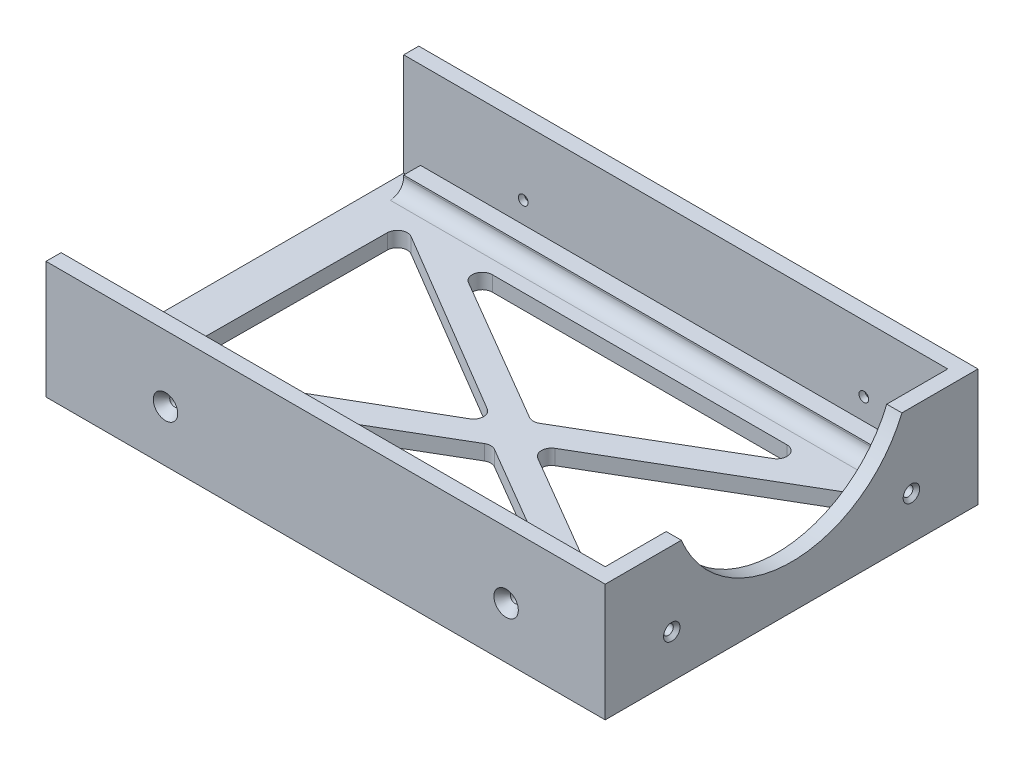
from build123d import *
from OCP.BRepFilletAPI import BRepFilletAPI_MakeChamfer

# Parameters (mm, degrees)
SKETCH1_W                     = 166.5
SKETCH1_H                     = 111
BOSS_EXTRUDE1_DEPTH           = 30.5
SHELL1_T                      = -4.5
CUT_EXTRUDE1_REACH            = 105.377
SKETCH2_W                     = 157
SKETCH2_H                     = 92
TAP_DRILL_FOR_6_32_TAP1_D     = 2.90068
TAP_DRILL_FOR_6_32_TAP1_DEPTH = 4.5
LPATTERN1_COUNT               = 8
LPATTERN1_PITCH               = 30.5
SKETCH7_W                     = 102
SKETCH7_H                     = 4.5
CUT_EXTRUDE2_DEPTH            = 5
SKETCH8_W                     = 102
SKETCH8_H                     = 157
CUT_EXTRUDE3_DEPTH            = 5
CUT_EXTRUDE4_REACH            = 302.564
SKETCH9_R                     = 35.5
TAP_DRILL_FOR_6_32_TAP2_D     = 2.90068
SKETCH13_W                    = 166.5
SKETCH13_H                    = 92
BOSS_EXTRUDE2_DEPTH           = 4.5
CUT_EXTRUDE7_DEPTH            = 157
MIRROR6_COPY_1_DEPTH          = 157
CUT_EXTRUDE11_REACH           = 364.095
SKETCH31_W                    = 5
SKETCH31_H                    = 102
SKETCH33_W                    = 4.5
SKETCH33_H                    = 149.2
BOSS_EXTRUDE3_DEPTH           = 4.5
LPATTERN2_COUNT               = 3
LPATTERN2_PITCH               = 81
CUT_EXTRUDE12_REACH           = 394.531
SKETCH34_W                    = 4.5
SKETCH34_H                    = 11.5
SKETCH35_W                    = 4.5
SKETCH35_H                    = 149.2
BOSS_EXTRUDE4_DEPTH           = 4.5
SKETCH36_W                    = 14
SKETCH36_H                    = 38
SKETCH36_W_2                  = 24
SKETCH36_H_2                  = 12
SKETCH36_W_3                  = 12
SKETCH36_H_3                  = 14
BOSS_EXTRUDE5_DEPTH           = 4.5
CUT_EXTRUDE13_REACH           = 394.531
SKETCH37_R                    = 1.45
BOSS_EXTRUDE6_START           = -4.5
BOSS_EXTRUDE6_DEPTH           = 4.5
SKETCH39_R                    = 3.5
CUT_EXTRUDE14_DEPTH           = 2.5
CUT_EXTRUDE14_DRAFT           = -39
CUT_EXTRUDE14_PROFILE_2_DEPTH = 2.5
CUT_EXTRUDE14_PROFILE_2_DRAFT = -39
CUT_EXTRUDE14_PROFILE_3_DEPTH = 2.5
CUT_EXTRUDE14_PROFILE_3_DRAFT = -39
CUT_EXTRUDE14_PROFILE_4_DEPTH = 2.5
CUT_EXTRUDE14_PROFILE_4_DRAFT = -39
CHAMFER1_SIZE                 = 4.5
SKETCH41_W                    = 166.5
SKETCH41_H                    = 314
BOSS_EXTRUDE7_DEPTH           = 4.5
CUT_EXTRUDE15_REACH           = 367.087
CHAMFER2_SIZE                 = 2.7
CHAMFER2_SIZE2                = 2.18641689
CHAMFER3_SIZE                 = 2.7
CHAMFER3_SIZE2                = 2.18641689
CHAMFER4_SIZE                 = 2.7
CHAMFER4_SIZE2                = 2.18641689
CHAMFER5_SIZE                 = 1
FILLET1_R                     = 4
FILLET2_R                     = 4
FILLET3_R                     = 4
CHAMFER6_SIZE                 = 20
CUT_EXTRUDE16_DEPTH           = 393.530890547
CUT_EXTRUDE16_DEPTH_BACK      = 393.530890547


with BuildPart() as part:
    # Sketch1 → Boss-Extrude1 (new body)
    with BuildSketch(Plane(origin=(0, 0, 0), x_dir=(1, 0, 0), z_dir=(0, 1, 0))):
        Rectangle(SKETCH1_W, SKETCH1_H)
    extrude(amount=BOSS_EXTRUDE1_DEPTH)

    # Shell1
    shell1_openings = [part.faces().sort_by_distance(p)[0] for p in [
        (0, 30.5, 0),
        (-83.25, 15.25, 0),
    ]]
    offset(amount=SHELL1_T, openings=shell1_openings, kind=Kind.INTERSECTION)

    # Sketch2 → Cut-Extrude1 (cut, up to next)
    with BuildSketch(Plane(origin=(0, 4.5, 0), x_dir=(1, 0, 0), z_dir=(0, 1, 0)), mode=Mode.PRIVATE) as cut_extrude1_sk1:
        with Locations((0.25, 0)):
            Rectangle(SKETCH2_W, SKETCH2_H)
    cut_extrude1_tool1 = extrude(cut_extrude1_sk1.sketch, amount=-CUT_EXTRUDE1_REACH, mode=Mode.PRIVATE) & part.part
    add(cut_extrude1_tool1.solids().sort_by_distance((0.25, 4.5, 0))[0], mode=Mode.SUBTRACT)

    # Tap Drill for #6-32 Tap1
    with Locations(Plane(origin=(0, 0, -55.5), x_dir=(-1, 0, 0), z_dir=(0, 0, -1))):
        with Locations((47.66, 10.84), (-53.75, 10.84)):
            tap_drill_for_6_32_tap1 = Hole(TAP_DRILL_FOR_6_32_TAP1_D / 2, depth=TAP_DRILL_FOR_6_32_TAP1_DEPTH)

    # Mirror1: Tap Drill for #6-32 Tap1 across plane
    add(tap_drill_for_6_32_tap1.mirror(Plane.XY), mode=Mode.SUBTRACT)


with BuildPart() as lpattern1_1:
    # LPattern1: pattern copy
    add(part.part.moved(Location(Vector(0, 1, 0) * (1 * LPATTERN1_PITCH))))


with BuildPart() as lpattern1_2:
    # LPattern1: pattern copy
    add(part.part.moved(Location(Vector(0, 1, 0) * (2 * LPATTERN1_PITCH))))


with BuildPart() as lpattern1_3:
    # LPattern1: pattern copy
    add(part.part.moved(Location(Vector(0, 1, 0) * (3 * LPATTERN1_PITCH))))


with BuildPart() as lpattern1_4:
    # LPattern1: pattern copy
    add(part.part.moved(Location(Vector(0, 1, 0) * (4 * LPATTERN1_PITCH))))


with BuildPart() as lpattern1_5:
    # LPattern1: pattern copy
    add(part.part.moved(Location(Vector(0, 1, 0) * (5 * LPATTERN1_PITCH))))


with BuildPart() as lpattern1_6:
    # LPattern1: pattern copy
    add(part.part.moved(Location(Vector(0, 1, 0) * (6 * LPATTERN1_PITCH))))


with BuildPart() as lpattern1_7:
    # LPattern1: pattern copy
    add(part.part.moved(Location(Vector(0, 1, 0) * (7 * LPATTERN1_PITCH))))


with BuildPart() as part_1:
    add(part.part)

    # Combine1: union LPattern1_1
    add(lpattern1_1.part)

    # Sketch7 → Cut-Extrude2 (cut)
    with BuildSketch(Plane.ZY.offset(83.25)):
        with Locations((0, 32.75)):
            Rectangle(SKETCH7_W, SKETCH7_H)
    extrude(amount=-CUT_EXTRUDE2_DEPTH, mode=Mode.SUBTRACT)


with BuildPart() as lpattern1_2_1:
    add(lpattern1_2.part)

    # Combine2: union LPattern1_3, LPattern1_5, LPattern1_4, LPattern1_7, part, LPattern1_6
    add(lpattern1_3.part)
    add(lpattern1_5.part)
    add(lpattern1_4.part)
    add(lpattern1_7.part)
    add(part_1.part)
    add(lpattern1_6.part)

    # Sketch8 → Cut-Extrude3 (cut)
    with BuildSketch(Plane.ZY.offset(83.25)):
        with Locations((0, 139.5)):
            Rectangle(SKETCH8_W, SKETCH8_H)
    extrude(amount=-CUT_EXTRUDE3_DEPTH, mode=Mode.SUBTRACT)

    # Sketch9 → Cut-Extrude4 (cut, up to next)
    with BuildSketch(Plane(origin=(83.25, 0, 0), x_dir=(0, 0, -1), z_dir=(1, 0, 0)), mode=Mode.PRIVATE) as cut_extrude4_sk1:
        with Locations((0, 204)):
            Circle(SKETCH9_R)
    cut_extrude4_tool1 = extrude(cut_extrude4_sk1.sketch, amount=-CUT_EXTRUDE4_REACH, mode=Mode.PRIVATE) & lpattern1_2_1.part
    # Sketch9 → Cut-Extrude4 (cut, up to next)
    with BuildSketch(Plane(origin=(83.25, 0, 0), x_dir=(0, 0, -1), z_dir=(1, 0, 0)), mode=Mode.PRIVATE) as cut_extrude4_sk2:
        with Locations((0, 124)):
            Circle(SKETCH9_R)
    cut_extrude4_tool2 = extrude(cut_extrude4_sk2.sketch, amount=-CUT_EXTRUDE4_REACH, mode=Mode.PRIVATE) & lpattern1_2_1.part
    # Sketch9 → Cut-Extrude4 (cut, up to next)
    with BuildSketch(Plane(origin=(83.25, 0, 0), x_dir=(0, 0, -1), z_dir=(1, 0, 0)), mode=Mode.PRIVATE) as cut_extrude4_sk3:
        with Locations((0, 44)):
            Circle(SKETCH9_R)
    cut_extrude4_tool3 = extrude(cut_extrude4_sk3.sketch, amount=-CUT_EXTRUDE4_REACH, mode=Mode.PRIVATE) & lpattern1_2_1.part
    add(cut_extrude4_tool1.solids().sort_by_distance((83.25, 204, 0))[0], mode=Mode.SUBTRACT)
    add(cut_extrude4_tool2.solids().sort_by_distance((83.25, 124, 0))[0], mode=Mode.SUBTRACT)
    add(cut_extrude4_tool3.solids().sort_by_distance((83.25, 44, 0))[0], mode=Mode.SUBTRACT)

    # Tap Drill for #6-32 Tap2 (through all)
    with Locations(Plane(origin=(83.25, 0, 0), x_dir=(0, 0, -1), z_dir=(1, 0, 0))):
        with Locations((-35.675, 239.675), (35.675, 239.675), (35.675, 168.325), (-35.675, 168.325)):
            tap_drill_for_6_32_tap2 = Hole(TAP_DRILL_FOR_6_32_TAP2_D / 2)

    # Mirror2: Tap Drill for #6-32 Tap2 across plane
    add(tap_drill_for_6_32_tap2.mirror(Plane.ZX.offset(164)), mode=Mode.SUBTRACT)

    # Mirror3: Tap Drill for #6-32 Tap2 across plane
    add(tap_drill_for_6_32_tap2.mirror(Plane.ZX.offset(124)), mode=Mode.SUBTRACT)

    # Sketch13 → Boss-Extrude2 (add)
    with BuildSketch(Plane.XZ):
        with Locations((0, -101.5)):
            Rectangle(SKETCH13_W, SKETCH13_H)
    extrude(amount=-BOSS_EXTRUDE2_DEPTH)

    # Mirror4: LPattern1_2 across plane


with BuildPart() as lpattern1_2_2:
    add(lpattern1_2_1.part)
    add(lpattern1_2_1.part.mirror(Plane(origin=(0, 0, -101.5), x_dir=(1, 0, 0), z_dir=(0, 0, -1))))

    # Sketch17 → Cut-Extrude7 (cut)
    with BuildSketch(Plane.ZY.offset(78.25)):
        Polygon((-46, 35), (-51, 30.5), (-46, 30.5), align=None)
        Polygon((-51, 61), (-46, 65.5), (-46, 61), align=None)
        Polygon((-51, 91.5), (-46, 96), (-46, 91.5), align=None)
        Polygon((-51, 122), (-46, 126.5), (-46, 122), align=None)
        Polygon((-51, 152.5), (-46, 157), (-46, 152.5), align=None)
        Polygon((-51, 183), (-46, 187.5), (-46, 183), align=None)
        Polygon((-51, 213.5), (-46, 218), (-46, 213.5), align=None)
    cut_extrude7 = extrude(amount=-CUT_EXTRUDE7_DEPTH, mode=Mode.SUBTRACT)

    # Mirror5: Cut-Extrude7 across plane
    add(cut_extrude7.mirror(Plane.XY), mode=Mode.SUBTRACT)

    # Mirror6: Cut-Extrude7 across plane
    add(cut_extrude7.mirror(Plane(origin=(0, 0, -101.5), x_dir=(1, 0, 0), z_dir=(0, 0, -1))), mode=Mode.SUBTRACT)

    # Mirror6 copy 1 sketch → Mirror6 copy 1 (cut)
    with BuildSketch(Plane(origin=(-78.25, 0, -203), x_dir=(0, 0, 1), z_dir=(-1, 0, 0))):
        Polygon((-46, 35), (-51, 30.5), (-46, 30.5), align=None)
        Polygon((-51, 61), (-46, 65.5), (-46, 61), align=None)
        Polygon((-51, 91.5), (-46, 96), (-46, 91.5), align=None)
        Polygon((-51, 122), (-46, 126.5), (-46, 122), align=None)
        Polygon((-51, 152.5), (-46, 157), (-46, 152.5), align=None)
        Polygon((-51, 183), (-46, 187.5), (-46, 183), align=None)
        Polygon((-51, 213.5), (-46, 218), (-46, 213.5), align=None)
    extrude(amount=-MIRROR6_COPY_1_DEPTH, mode=Mode.SUBTRACT)

    # Sketch31 → Cut-Extrude11 (cut, up to next)
    with BuildSketch(Plane(origin=(0, 4.5, 0), x_dir=(1, 0, 0), z_dir=(0, 1, 0)), mode=Mode.PRIVATE) as cut_extrude11_sk1:
        with Locations((-80.75, 203)):
            Rectangle(SKETCH31_W, SKETCH31_H)
    cut_extrude11_tool1 = extrude(cut_extrude11_sk1.sketch, amount=-CUT_EXTRUDE11_REACH, mode=Mode.PRIVATE) & lpattern1_2_2.part
    # Sketch31 → Cut-Extrude11 (cut, up to next)
    with BuildSketch(Plane(origin=(0, 4.5, 0), x_dir=(1, 0, 0), z_dir=(0, 1, 0)), mode=Mode.PRIVATE) as cut_extrude11_sk2:
        with Locations((-80.75, 0)):
            Rectangle(SKETCH31_W, SKETCH31_H)
    cut_extrude11_tool2 = extrude(cut_extrude11_sk2.sketch, amount=-CUT_EXTRUDE11_REACH, mode=Mode.PRIVATE) & lpattern1_2_2.part
    add(cut_extrude11_tool1.solids().sort_by_distance((-80.75, 4.5, -203))[0], mode=Mode.SUBTRACT)
    add(cut_extrude11_tool2.solids().sort_by_distance((-80.75, 4.5, 0))[0], mode=Mode.SUBTRACT)

    # Sketch33 → Boss-Extrude3 (add)
    with BuildSketch(Plane(origin=(83.25, 0, 0), x_dir=(0, 0, -1), z_dir=(1, 0, 0))):
        with Locations((145.25, 79.1)):
            Rectangle(SKETCH33_W, SKETCH33_H)
    boss_extrude3 = extrude(amount=-BOSS_EXTRUDE3_DEPTH)

    # LPattern2: Boss-Extrude3 ×3
    with Locations(*[(-i * LPATTERN2_PITCH, 0, 0) for i in range(1, LPATTERN2_COUNT)]):
        add(boss_extrude3)

    # Cut-Extrude12: up to this face of the body (flat: up to its plane)
    cut_extrude12_end = Plane(lpattern1_2_2.part.faces().sort_by_distance((2.25, 79.1, -145.25))[0])
    # Sketch34 → Cut-Extrude12 (cut, up to the picked face)
    with BuildSketch(Plane.ZY.offset(83.25), mode=Mode.PRIVATE) as cut_extrude12_sk1:
        Polygon((-147.5, 25), (-143, 25), (-143, 81.35), (-147.5, 76.85), align=None)
    cut_extrude12_tool1 = split(extrude(cut_extrude12_sk1.sketch, amount=-CUT_EXTRUDE12_REACH, mode=Mode.PRIVATE), bisect_by=cut_extrude12_end, keep=Keep.BOTH, mode=Mode.PRIVATE)
    # Sketch34 → Cut-Extrude12 (cut, up to the picked face)
    with BuildSketch(Plane.ZY.offset(83.25), mode=Mode.PRIVATE) as cut_extrude12_sk2:
        with Locations((-145.25, 19.25)):
            Rectangle(SKETCH34_W, SKETCH34_H)
    cut_extrude12_tool2 = split(extrude(cut_extrude12_sk2.sketch, amount=-CUT_EXTRUDE12_REACH, mode=Mode.PRIVATE), bisect_by=cut_extrude12_end, keep=Keep.BOTH, mode=Mode.PRIVATE)
    # Sketch34 → Cut-Extrude12 (cut, up to the picked face)
    with BuildSketch(Plane.ZY.offset(83.25), mode=Mode.PRIVATE) as cut_extrude12_sk3:
        Polygon((-143, 145.7), (-143, 89.35), (-147.5, 89.35), (-147.5, 141.2), align=None)
    cut_extrude12_tool3 = split(extrude(cut_extrude12_sk3.sketch, amount=-CUT_EXTRUDE12_REACH, mode=Mode.PRIVATE), bisect_by=cut_extrude12_end, keep=Keep.BOTH, mode=Mode.PRIVATE)
    add(cut_extrude12_tool1.solids().sort_by(Axis((-83.25, 52.065596, -145.218808), (1, 0, 0)))[0], mode=Mode.SUBTRACT)
    add(cut_extrude12_tool2.solids().sort_by(Axis((-83.25, 19.25, -145.25), (1, 0, 0)))[0], mode=Mode.SUBTRACT)
    add(cut_extrude12_tool3.solids().sort_by(Axis((-83.25, 116.415596, -145.218808), (1, 0, 0)))[0], mode=Mode.SUBTRACT)

    # Sketch35 → Boss-Extrude4 (add)
    with BuildSketch(Plane.ZY.offset(-78.75)):
        with Locations((-145.25, 79.1)):
            Rectangle(SKETCH35_W, SKETCH35_H)
    extrude(amount=BOSS_EXTRUDE4_DEPTH)

    # Sketch36 → Boss-Extrude5 (add)
    with BuildSketch(Plane(origin=(83.25, 0, 0), x_dir=(0, 0, -1), z_dir=(1, 0, 0))):
        with Locations((62.5, 23.5)):
            Rectangle(SKETCH36_W, SKETCH36_H)
        with Locations((67.5, 147.7)):
            Rectangle(SKETCH36_W_2, SKETCH36_H_2)
        with Locations((137, 146.7)):
            Rectangle(SKETCH36_W_3, SKETCH36_H_3)
        with Locations((136, 10.5)):
            Rectangle(SKETCH36_W, SKETCH36_H_2)
    extrude(amount=-BOSS_EXTRUDE5_DEPTH)

    # Sketch37 → Cut-Extrude13 (cut, up to next)
    with BuildSketch(Plane(origin=(83.25, 0, 0), x_dir=(0, 0, -1), z_dir=(1, 0, 0)), mode=Mode.PRIVATE) as cut_extrude13_sk1:
        with Locations((71.32, 147.92)):
            Circle(SKETCH37_R)
    cut_extrude13_tool1 = extrude(cut_extrude13_sk1.sketch, amount=-CUT_EXTRUDE13_REACH, mode=Mode.PRIVATE) & lpattern1_2_2.part
    # Sketch37 → Cut-Extrude13 (cut, up to next)
    with BuildSketch(Plane(origin=(83.25, 0, 0), x_dir=(0, 0, -1), z_dir=(1, 0, 0)), mode=Mode.PRIVATE) as cut_extrude13_sk2:
        with Locations((137.68, 147.92)):
            Circle(SKETCH37_R)
    cut_extrude13_tool2 = extrude(cut_extrude13_sk2.sketch, amount=-CUT_EXTRUDE13_REACH, mode=Mode.PRIVATE) & lpattern1_2_2.part
    # Sketch37 → Cut-Extrude13 (cut, up to next)
    with BuildSketch(Plane(origin=(83.25, 0, 0), x_dir=(0, 0, -1), z_dir=(1, 0, 0)), mode=Mode.PRIVATE) as cut_extrude13_sk3:
        with Locations((61.57, 34.51)):
            Circle(SKETCH37_R)
    cut_extrude13_tool3 = extrude(cut_extrude13_sk3.sketch, amount=-CUT_EXTRUDE13_REACH, mode=Mode.PRIVATE) & lpattern1_2_2.part
    # Sketch37 → Cut-Extrude13 (cut, up to next)
    with BuildSketch(Plane(origin=(83.25, 0, 0), x_dir=(0, 0, -1), z_dir=(1, 0, 0)), mode=Mode.PRIVATE) as cut_extrude13_sk4:
        with Locations((137.55, 10.15)):
            Circle(SKETCH37_R)
    cut_extrude13_tool4 = extrude(cut_extrude13_sk4.sketch, amount=-CUT_EXTRUDE13_REACH, mode=Mode.PRIVATE) & lpattern1_2_2.part
    add(cut_extrude13_tool1.solids().sort_by_distance((83.25, 147.92, -71.32))[0], mode=Mode.SUBTRACT)
    add(cut_extrude13_tool2.solids().sort_by_distance((83.25, 147.92, -137.68))[0], mode=Mode.SUBTRACT)
    add(cut_extrude13_tool3.solids().sort_by_distance((83.25, 34.51, -61.57))[0], mode=Mode.SUBTRACT)
    add(cut_extrude13_tool4.solids().sort_by_distance((83.25, 10.15, -137.55))[0], mode=Mode.SUBTRACT)

    # Sketch38 → Boss-Extrude6 (add)
    with BuildSketch(Plane(origin=(83.25, 0, 0), x_dir=(0, 0, -1), z_dir=(1, 0, 0)).offset(BOSS_EXTRUDE6_START)):
        Polygon((79.5, 141.7), (55.5, 117.7), (55.5, 141.7), align=None)
        Polygon((131, 139.7), (143, 127.7), (143, 139.7), align=None)
    extrude(amount=BOSS_EXTRUDE6_DEPTH)


with BuildPart() as cut_extrude14_tool:
    # Sketch39 → Cut-Extrude14 (with draft: the straight prism first)
    with BuildSketch(Plane(origin=(83.25, 0, 0), x_dir=(0, 0, -1), z_dir=(1, 0, 0))):
        with Locations((71.32, 147.92)):
            Circle(SKETCH39_R)
    extrude(amount=-CUT_EXTRUDE14_DEPTH)
    # Cut-Extrude14: the draft: its side faces are tilted about the plane it starts from
    cut_extrude14_sides = [cut_extrude14_tool.faces().sort_by_distance(p)[0] for p in [
        (82, 147.92, -67.82),
    ]]
    draft(cut_extrude14_sides, Plane(origin=(83.25, 0, 0), x_dir=(0, 0, -1), z_dir=(1, 0, 0)), CUT_EXTRUDE14_DRAFT)


with BuildPart() as lpattern1_2_3:
    add(lpattern1_2_2.part)

    # Cut-Extrude14: cut by cut_extrude14_tool
    add(cut_extrude14_tool.part, mode=Mode.SUBTRACT)


with BuildPart() as cut_extrude14_profile_2_tool:
    # Sketch39 → Cut-Extrude14 profile 2 (with draft: the straight prism first)
    with BuildSketch(Plane(origin=(83.25, 0, 0), x_dir=(0, 0, -1), z_dir=(1, 0, 0))):
        with Locations((137.68, 147.92)):
            Circle(SKETCH39_R)
    extrude(amount=-CUT_EXTRUDE14_PROFILE_2_DEPTH)
    # Cut-Extrude14 profile 2: the draft: its side faces are tilted about the plane it starts from
    cut_extrude14_profile_2_sides = [cut_extrude14_profile_2_tool.faces().sort_by_distance(p)[0] for p in [
        (82, 147.92, -134.18),
    ]]
    draft(cut_extrude14_profile_2_sides, Plane(origin=(83.25, 0, 0), x_dir=(0, 0, -1), z_dir=(1, 0, 0)), CUT_EXTRUDE14_PROFILE_2_DRAFT)


with BuildPart() as lpattern1_2_4:
    add(lpattern1_2_3.part)

    # Cut-Extrude14 profile 2: cut by cut_extrude14_profile_2_tool
    add(cut_extrude14_profile_2_tool.part, mode=Mode.SUBTRACT)


with BuildPart() as cut_extrude14_profile_3_tool:
    # Sketch39 → Cut-Extrude14 profile 3 (with draft: the straight prism first)
    with BuildSketch(Plane(origin=(83.25, 0, 0), x_dir=(0, 0, -1), z_dir=(1, 0, 0))):
        with Locations((137.55, 10.15)):
            Circle(SKETCH39_R)
    extrude(amount=-CUT_EXTRUDE14_PROFILE_3_DEPTH)
    # Cut-Extrude14 profile 3: the draft: its side faces are tilted about the plane it starts from
    cut_extrude14_profile_3_sides = [cut_extrude14_profile_3_tool.faces().sort_by_distance(p)[0] for p in [
        (82, 10.15, -134.05),
    ]]
    draft(cut_extrude14_profile_3_sides, Plane(origin=(83.25, 0, 0), x_dir=(0, 0, -1), z_dir=(1, 0, 0)), CUT_EXTRUDE14_PROFILE_3_DRAFT)


with BuildPart() as lpattern1_2_5:
    add(lpattern1_2_4.part)

    # Cut-Extrude14 profile 3: cut by cut_extrude14_profile_3_tool
    add(cut_extrude14_profile_3_tool.part, mode=Mode.SUBTRACT)


with BuildPart() as cut_extrude14_profile_4_tool:
    # Sketch39 → Cut-Extrude14 profile 4 (with draft: the straight prism first)
    with BuildSketch(Plane(origin=(83.25, 0, 0), x_dir=(0, 0, -1), z_dir=(1, 0, 0))):
        with Locations((61.57, 34.51)):
            Circle(SKETCH39_R)
    extrude(amount=-CUT_EXTRUDE14_PROFILE_4_DEPTH)
    # Cut-Extrude14 profile 4: the draft: its side faces are tilted about the plane it starts from
    cut_extrude14_profile_4_sides = [cut_extrude14_profile_4_tool.faces().sort_by_distance(p)[0] for p in [
        (82, 34.51, -58.07),
    ]]
    draft(cut_extrude14_profile_4_sides, Plane(origin=(83.25, 0, 0), x_dir=(0, 0, -1), z_dir=(1, 0, 0)), CUT_EXTRUDE14_PROFILE_4_DRAFT)


with BuildPart() as lpattern1_2_6:
    add(lpattern1_2_5.part)

    # Cut-Extrude14 profile 4: cut by cut_extrude14_profile_4_tool
    add(cut_extrude14_profile_4_tool.part, mode=Mode.SUBTRACT)

    # Chamfer1
    chamfer1_edges = [lpattern1_2_6.edges().sort_by_distance(p)[0] for p in [
        (81, 42.5, -69.5),
        (81, 153.7, -79.5),
        (81, 153.7, -131),
        (81, 16.5, -129),
    ]]
    chamfer(chamfer1_edges, length=CHAMFER1_SIZE)

    # Sketch41 → Boss-Extrude7 (add)
    with BuildSketch(Plane.XZ):
        with Locations((0, -101.5)):
            Rectangle(SKETCH41_W, SKETCH41_H)
    extrude(amount=BOSS_EXTRUDE7_DEPTH)

    # Sketch42 → Cut-Extrude15 (cut, up to next)
    with BuildSketch(Plane(origin=(0, 0, 0), x_dir=(1, 0, 0), z_dir=(0, 1, 0)), mode=Mode.PRIVATE) as cut_extrude15_sk1:
        with BuildLine():
            Line((-43.85503675, 38), (43.85503675, 38))
            ThreePointArc((43.85503675, 38), (46.750439422, 35.78526643), (45.370811763, 32.411095577))
            Line((45.370811763, 32.411095577), (1.515775013, 6.73445479))
            ThreePointArc((1.515775013, 6.73445479), (0, 6.323359212), (-1.515775013, 6.73445479))
            Line((-1.515775013, 6.73445479), (-45.370811763, 32.411095577))
            ThreePointArc((-45.370811763, 32.411095577), (-46.750439422, 35.78526643), (-43.85503675, 38))
        make_face()
    cut_extrude15_tool1 = extrude(cut_extrude15_sk1.sketch, amount=-CUT_EXTRUDE15_REACH, mode=Mode.PRIVATE) & lpattern1_2_6.part
    # Sketch42 → Cut-Extrude15 (cut, up to next)
    with BuildSketch(Plane(origin=(0, 0, 0), x_dir=(1, 0, 0), z_dir=(0, 1, 0)), mode=Mode.PRIVATE) as cut_extrude15_sk2:
        with BuildLine():
            Line((10.268766853, 2.588904423), (66.234224987, 35.356063488))
            ThreePointArc((66.234224987, 35.356063488), (69.242091646, 35.369785147), (70.75, 32.767159066))
            Line((70.75, 32.767159066), (70.75, -32.767159066))
            ThreePointArc((70.75, -32.767159066), (69.242091646, -35.369785147), (66.234224987, -35.356063488))
            Line((66.234224987, -35.356063488), (10.268766853, -2.588904423))
            ThreePointArc((10.268766853, -2.588904423), (8.784541866, 0), (10.268766853, 2.588904423))
        make_face()
    cut_extrude15_tool2 = extrude(cut_extrude15_sk2.sketch, amount=-CUT_EXTRUDE15_REACH, mode=Mode.PRIVATE) & lpattern1_2_6.part
    # Sketch42 → Cut-Extrude15 (cut, up to next)
    with BuildSketch(Plane(origin=(0, 0, 0), x_dir=(1, 0, 0), z_dir=(0, 1, 0)), mode=Mode.PRIVATE) as cut_extrude15_sk3:
        with BuildLine():
            Line((45.370811763, -32.411095577), (1.515775013, -6.73445479))
            ThreePointArc((1.515775013, -6.73445479), (0, -6.323359212), (-1.515775013, -6.73445479))
            Line((-1.515775013, -6.73445479), (-45.370811763, -32.411095577))
            ThreePointArc((-45.370811763, -32.411095577), (-46.750439422, -35.78526643), (-43.85503675, -38))
            Line((-43.85503675, -38), (43.85503675, -38))
            ThreePointArc((43.85503675, -38), (46.750439422, -35.78526643), (45.370811763, -32.411095577))
        make_face()
    cut_extrude15_tool3 = extrude(cut_extrude15_sk3.sketch, amount=-CUT_EXTRUDE15_REACH, mode=Mode.PRIVATE) & lpattern1_2_6.part
    # Sketch42 → Cut-Extrude15 (cut, up to next)
    with BuildSketch(Plane(origin=(0, 0, 0), x_dir=(1, 0, 0), z_dir=(0, 1, 0)), mode=Mode.PRIVATE) as cut_extrude15_sk4:
        with BuildLine():
            Line((-70.717599058, 32.346124545), (-70.327517287, -33.187032629))
            ThreePointArc((-70.327517287, -33.187032629), (-68.804143961, -35.780637039), (-65.796412263, -35.749011813))
            Line((-65.796412263, -35.749011813), (-10.026986458, -2.64930845))
            ThreePointArc((-10.026986458, -2.64930845), (-8.558197773, -0.051615297), (-10.057806476, 2.528408669))
            Line((-10.057806476, 2.528408669), (-66.217314052, 34.961862479))
            ThreePointArc((-66.217314052, 34.961862479), (-69.225209102, 34.957680085), (-70.717599058, 32.346124545))
        make_face()
    cut_extrude15_tool4 = extrude(cut_extrude15_sk4.sketch, amount=-CUT_EXTRUDE15_REACH, mode=Mode.PRIVATE) & lpattern1_2_6.part
    cut_extrude15_1 = cut_extrude15_tool1.solids().sort_by_distance((0, 0, -27.06052))[0]
    add(cut_extrude15_1, mode=Mode.SUBTRACT)
    cut_extrude15_2 = cut_extrude15_tool2.solids().sort_by_distance((49.111692, 0, 0))[0]
    add(cut_extrude15_2, mode=Mode.SUBTRACT)
    cut_extrude15_3 = cut_extrude15_tool3.solids().sort_by_distance((0, 0, 27.06052))[0]
    add(cut_extrude15_3, mode=Mode.SUBTRACT)
    cut_extrude15_4 = cut_extrude15_tool4.solids().sort_by_distance((-48.884634, 0, 0.291656))[0]
    add(cut_extrude15_4, mode=Mode.SUBTRACT)
    cut_extrude15 = cut_extrude15_1 + cut_extrude15_2 + cut_extrude15_3 + cut_extrude15_4  # Cut-Extrude15 as one shape, for the pattern or mirror that repeats it

    # Mirror7: Cut-Extrude15 across plane
    add(cut_extrude15.mirror(Plane(origin=(0, 0, -101.5), x_dir=(1, 0, 0), z_dir=(0, 0, -1))), mode=Mode.SUBTRACT)

    # Chamfer2
    chamfer2_edges = [lpattern1_2_6.edges().sort_by_distance(p)[0] for p in [
        (52.29966, 10.84, 55.5),
        (-49.11034, 10.84, 55.5),
        (52.29966, 41.34, 55.5),
        (-49.11034, 41.34, 55.5),
        (52.29966, 71.84, 55.5),
        (-49.11034, 71.84, 55.5),
        (52.29966, 102.34, 55.5),
        (-49.11034, 102.34, 55.5),
        (52.29966, 163.34, 55.5),
        (-49.11034, 163.34, 55.5),
        (52.29966, 132.84, 55.5),
        (-49.11034, 132.84, 55.5),
        (52.29966, 224.34, 55.5),
        (-49.11034, 224.34, 55.5),
        (52.29966, 193.84, 55.5),
        (-49.11034, 193.84, 55.5),
    ]]
    chamfer2_side = [lpattern1_2_6.faces().sort_by_distance(p)[0] for p in [
        (-0.007801308, 119.755533933, 55.5),
    ]]
    chamfer(chamfer2_edges, length=CHAMFER2_SIZE, length2=CHAMFER2_SIZE2, reference=chamfer2_side[0])

    # Chamfer3
    chamfer3_edges = [lpattern1_2_6.edges().sort_by_distance(p)[0] for p in [
        (52.29966, 10.84, -55.5),
        (-49.11034, 10.84, -55.5),
        (52.29966, 41.34, -55.5),
        (-49.11034, 41.34, -55.5),
        (52.29966, 71.84, -55.5),
        (-49.11034, 71.84, -55.5),
        (52.29966, 102.34, -55.5),
        (-49.11034, 102.34, -55.5),
        (52.29966, 163.34, -55.5),
        (-49.11034, 163.34, -55.5),
        (52.29966, 132.84, -55.5),
        (-49.11034, 132.84, -55.5),
        (52.29966, 224.34, -55.5),
        (-49.11034, 224.34, -55.5),
        (52.29966, 193.84, -55.5),
        (-49.11034, 193.84, -55.5),
    ]]
    chamfer3_side = [lpattern1_2_6.faces().sort_by_distance(p)[0] for p in [
        (-0.692097578, 124.65766578, -55.5),
    ]]
    chamfer(chamfer3_edges, length=CHAMFER3_SIZE, length2=CHAMFER3_SIZE2, reference=chamfer3_side[0])

    # Chamfer4: one chamfer whose edges measure the first distance from different faces: ONE call of the kernel's chamfer builder (chamfer() names one face for all edges)
    chamfer4_edges_1 = [lpattern1_2_6.edges().sort_by_distance(p)[0] for p in [
        (-49.11034, 71.84, -147.5),
    ]]
    chamfer4_side_1 = [lpattern1_2_6.faces().sort_by_distance(p)[0] for p in [
        (-49.11034, 71.84, -149.75),
    ]]
    chamfer4_edges_2 = [lpattern1_2_6.edges().sort_by_distance(p)[0] for p in [
        (52.29966, 71.84, -147.5),
    ]]
    chamfer4_side_2 = [lpattern1_2_6.faces().sort_by_distance(p)[0] for p in [
        (52.29966, 71.84, -149.75),
    ]]
    chamfer4_edges_3 = [lpattern1_2_6.edges().sort_by_distance(p)[0] for p in [
        (-49.11034, 102.34, -147.5),
    ]]
    chamfer4_side_3 = [lpattern1_2_6.faces().sort_by_distance(p)[0] for p in [
        (-49.11034, 102.34, -149.75),
    ]]
    chamfer4_edges_4 = [lpattern1_2_6.edges().sort_by_distance(p)[0] for p in [
        (52.29966, 102.34, -147.5),
    ]]
    chamfer4_side_4 = [lpattern1_2_6.faces().sort_by_distance(p)[0] for p in [
        (52.29966, 102.34, -149.75),
    ]]
    chamfer4_edges_5 = [lpattern1_2_6.edges().sort_by_distance(p)[0] for p in [
        (-49.11034, 163.34, -147.5),
    ]]
    chamfer4_side_5 = [lpattern1_2_6.faces().sort_by_distance(p)[0] for p in [
        (-49.11034, 163.34, -149.75),
    ]]
    chamfer4_edges_6 = [lpattern1_2_6.edges().sort_by_distance(p)[0] for p in [
        (52.29966, 163.34, -147.5),
    ]]
    chamfer4_side_6 = [lpattern1_2_6.faces().sort_by_distance(p)[0] for p in [
        (52.29966, 163.34, -149.75),
    ]]
    chamfer4_edges_7 = [lpattern1_2_6.edges().sort_by_distance(p)[0] for p in [
        (-49.11034, 132.84, -147.5),
    ]]
    chamfer4_side_7 = [lpattern1_2_6.faces().sort_by_distance(p)[0] for p in [
        (-49.11034, 132.84, -149.75),
    ]]
    chamfer4_edges_8 = [lpattern1_2_6.edges().sort_by_distance(p)[0] for p in [
        (52.29966, 132.84, -147.5),
    ]]
    chamfer4_side_8 = [lpattern1_2_6.faces().sort_by_distance(p)[0] for p in [
        (52.29966, 132.84, -149.75),
    ]]
    chamfer4_edges_9 = [lpattern1_2_6.edges().sort_by_distance(p)[0] for p in [
        (-49.11034, 224.34, -147.5),
    ]]
    chamfer4_side_9 = [lpattern1_2_6.faces().sort_by_distance(p)[0] for p in [
        (-49.11034, 224.34, -149.75),
    ]]
    chamfer4_edges_10 = [lpattern1_2_6.edges().sort_by_distance(p)[0] for p in [
        (52.29966, 224.34, -147.5),
    ]]
    chamfer4_side_10 = [lpattern1_2_6.faces().sort_by_distance(p)[0] for p in [
        (52.29966, 224.34, -149.75),
    ]]
    chamfer4_edges_11 = [lpattern1_2_6.edges().sort_by_distance(p)[0] for p in [
        (-49.11034, 193.84, -147.5),
    ]]
    chamfer4_side_11 = [lpattern1_2_6.faces().sort_by_distance(p)[0] for p in [
        (-49.11034, 193.84, -149.75),
    ]]
    chamfer4_edges_12 = [lpattern1_2_6.edges().sort_by_distance(p)[0] for p in [
        (52.29966, 193.84, -147.5),
    ]]
    chamfer4_side_12 = [lpattern1_2_6.faces().sort_by_distance(p)[0] for p in [
        (52.29966, 193.84, -149.75),
    ]]
    chamfer4_edges_13 = [lpattern1_2_6.edges().sort_by_distance(p)[0] for p in [
        (-49.11034, 10.84, -147.5),
    ]]
    chamfer4_side_13 = [lpattern1_2_6.faces().sort_by_distance(p)[0] for p in [
        (-49.11034, 10.84, -149.75),
    ]]
    chamfer4_edges_14 = [lpattern1_2_6.edges().sort_by_distance(p)[0] for p in [
        (52.29966, 10.84, -147.5),
    ]]
    chamfer4_side_14 = [lpattern1_2_6.faces().sort_by_distance(p)[0] for p in [
        (52.29966, 10.84, -149.75),
    ]]
    chamfer4_edges_15 = [lpattern1_2_6.edges().sort_by_distance(p)[0] for p in [
        (-49.11034, 41.34, -147.5),
    ]]
    chamfer4_side_15 = [lpattern1_2_6.faces().sort_by_distance(p)[0] for p in [
        (-49.11034, 41.34, -149.75),
    ]]
    chamfer4_edges_16 = [lpattern1_2_6.edges().sort_by_distance(p)[0] for p in [
        (52.29966, 41.34, -147.5),
    ]]
    chamfer4_side_16 = [lpattern1_2_6.faces().sort_by_distance(p)[0] for p in [
        (52.29966, 41.34, -149.75),
    ]]
    chamfer4_edges_17 = [lpattern1_2_6.edges().sort_by_distance(p)[0] for p in [
        (-49.11034, 71.84, -258.5),
    ]]
    chamfer4_side_17 = [lpattern1_2_6.faces().sort_by_distance(p)[0] for p in [
        (-49.11034, 71.84, -256.25),
    ]]
    chamfer4_edges_18 = [lpattern1_2_6.edges().sort_by_distance(p)[0] for p in [
        (52.29966, 71.84, -258.5),
    ]]
    chamfer4_side_18 = [lpattern1_2_6.faces().sort_by_distance(p)[0] for p in [
        (52.29966, 71.84, -256.25),
    ]]
    chamfer4_edges_19 = [lpattern1_2_6.edges().sort_by_distance(p)[0] for p in [
        (-49.11034, 102.34, -258.5),
    ]]
    chamfer4_side_19 = [lpattern1_2_6.faces().sort_by_distance(p)[0] for p in [
        (-49.11034, 102.34, -256.25),
    ]]
    chamfer4_edges_20 = [lpattern1_2_6.edges().sort_by_distance(p)[0] for p in [
        (52.29966, 102.34, -258.5),
    ]]
    chamfer4_side_20 = [lpattern1_2_6.faces().sort_by_distance(p)[0] for p in [
        (52.29966, 102.34, -256.25),
    ]]
    chamfer4_edges_21 = [lpattern1_2_6.edges().sort_by_distance(p)[0] for p in [
        (-49.11034, 163.34, -258.5),
    ]]
    chamfer4_side_21 = [lpattern1_2_6.faces().sort_by_distance(p)[0] for p in [
        (-49.11034, 163.34, -256.25),
    ]]
    chamfer4_edges_22 = [lpattern1_2_6.edges().sort_by_distance(p)[0] for p in [
        (52.29966, 163.34, -258.5),
    ]]
    chamfer4_side_22 = [lpattern1_2_6.faces().sort_by_distance(p)[0] for p in [
        (52.29966, 163.34, -256.25),
    ]]
    chamfer4_edges_23 = [lpattern1_2_6.edges().sort_by_distance(p)[0] for p in [
        (-49.11034, 132.84, -258.5),
    ]]
    chamfer4_side_23 = [lpattern1_2_6.faces().sort_by_distance(p)[0] for p in [
        (-49.11034, 132.84, -256.25),
    ]]
    chamfer4_edges_24 = [lpattern1_2_6.edges().sort_by_distance(p)[0] for p in [
        (52.29966, 132.84, -258.5),
    ]]
    chamfer4_side_24 = [lpattern1_2_6.faces().sort_by_distance(p)[0] for p in [
        (52.29966, 132.84, -256.25),
    ]]
    chamfer4_edges_25 = [lpattern1_2_6.edges().sort_by_distance(p)[0] for p in [
        (-49.11034, 224.34, -258.5),
    ]]
    chamfer4_side_25 = [lpattern1_2_6.faces().sort_by_distance(p)[0] for p in [
        (-49.11034, 224.34, -256.25),
    ]]
    chamfer4_edges_26 = [lpattern1_2_6.edges().sort_by_distance(p)[0] for p in [
        (52.29966, 224.34, -258.5),
    ]]
    chamfer4_side_26 = [lpattern1_2_6.faces().sort_by_distance(p)[0] for p in [
        (52.29966, 224.34, -256.25),
    ]]
    chamfer4_edges_27 = [lpattern1_2_6.edges().sort_by_distance(p)[0] for p in [
        (-49.11034, 193.84, -258.5),
    ]]
    chamfer4_side_27 = [lpattern1_2_6.faces().sort_by_distance(p)[0] for p in [
        (-49.11034, 193.84, -256.25),
    ]]
    chamfer4_edges_28 = [lpattern1_2_6.edges().sort_by_distance(p)[0] for p in [
        (52.29966, 193.84, -258.5),
    ]]
    chamfer4_side_28 = [lpattern1_2_6.faces().sort_by_distance(p)[0] for p in [
        (52.29966, 193.84, -256.25),
    ]]
    chamfer4_edges_29 = [lpattern1_2_6.edges().sort_by_distance(p)[0] for p in [
        (-49.11034, 10.84, -258.5),
    ]]
    chamfer4_side_29 = [lpattern1_2_6.faces().sort_by_distance(p)[0] for p in [
        (-49.11034, 10.84, -256.25),
    ]]
    chamfer4_edges_30 = [lpattern1_2_6.edges().sort_by_distance(p)[0] for p in [
        (52.29966, 10.84, -258.5),
    ]]
    chamfer4_side_30 = [lpattern1_2_6.faces().sort_by_distance(p)[0] for p in [
        (52.29966, 10.84, -256.25),
    ]]
    chamfer4_edges_31 = [lpattern1_2_6.edges().sort_by_distance(p)[0] for p in [
        (-49.11034, 41.34, -258.5),
    ]]
    chamfer4_side_31 = [lpattern1_2_6.faces().sort_by_distance(p)[0] for p in [
        (-49.11034, 41.34, -256.25),
    ]]
    chamfer4_edges_32 = [lpattern1_2_6.edges().sort_by_distance(p)[0] for p in [
        (52.29966, 41.34, -258.5),
    ]]
    chamfer4_side_32 = [lpattern1_2_6.faces().sort_by_distance(p)[0] for p in [
        (52.29966, 41.34, -256.25),
    ]]
    chamfer4 = BRepFilletAPI_MakeChamfer(lpattern1_2_6.part.solid().wrapped)
    for e in chamfer4_edges_1:
        chamfer4.Add(CHAMFER4_SIZE, CHAMFER4_SIZE2, e.wrapped, chamfer4_side_1[0].wrapped)  # the first distance lies on this face
    for e in chamfer4_edges_2:
        chamfer4.Add(CHAMFER4_SIZE, CHAMFER4_SIZE2, e.wrapped, chamfer4_side_2[0].wrapped)  # the first distance lies on this face
    for e in chamfer4_edges_3:
        chamfer4.Add(CHAMFER4_SIZE, CHAMFER4_SIZE2, e.wrapped, chamfer4_side_3[0].wrapped)  # the first distance lies on this face
    for e in chamfer4_edges_4:
        chamfer4.Add(CHAMFER4_SIZE, CHAMFER4_SIZE2, e.wrapped, chamfer4_side_4[0].wrapped)  # the first distance lies on this face
    for e in chamfer4_edges_5:
        chamfer4.Add(CHAMFER4_SIZE, CHAMFER4_SIZE2, e.wrapped, chamfer4_side_5[0].wrapped)  # the first distance lies on this face
    for e in chamfer4_edges_6:
        chamfer4.Add(CHAMFER4_SIZE, CHAMFER4_SIZE2, e.wrapped, chamfer4_side_6[0].wrapped)  # the first distance lies on this face
    for e in chamfer4_edges_7:
        chamfer4.Add(CHAMFER4_SIZE, CHAMFER4_SIZE2, e.wrapped, chamfer4_side_7[0].wrapped)  # the first distance lies on this face
    for e in chamfer4_edges_8:
        chamfer4.Add(CHAMFER4_SIZE, CHAMFER4_SIZE2, e.wrapped, chamfer4_side_8[0].wrapped)  # the first distance lies on this face
    for e in chamfer4_edges_9:
        chamfer4.Add(CHAMFER4_SIZE, CHAMFER4_SIZE2, e.wrapped, chamfer4_side_9[0].wrapped)  # the first distance lies on this face
    for e in chamfer4_edges_10:
        chamfer4.Add(CHAMFER4_SIZE, CHAMFER4_SIZE2, e.wrapped, chamfer4_side_10[0].wrapped)  # the first distance lies on this face
    for e in chamfer4_edges_11:
        chamfer4.Add(CHAMFER4_SIZE, CHAMFER4_SIZE2, e.wrapped, chamfer4_side_11[0].wrapped)  # the first distance lies on this face
    for e in chamfer4_edges_12:
        chamfer4.Add(CHAMFER4_SIZE, CHAMFER4_SIZE2, e.wrapped, chamfer4_side_12[0].wrapped)  # the first distance lies on this face
    for e in chamfer4_edges_13:
        chamfer4.Add(CHAMFER4_SIZE, CHAMFER4_SIZE2, e.wrapped, chamfer4_side_13[0].wrapped)  # the first distance lies on this face
    for e in chamfer4_edges_14:
        chamfer4.Add(CHAMFER4_SIZE, CHAMFER4_SIZE2, e.wrapped, chamfer4_side_14[0].wrapped)  # the first distance lies on this face
    for e in chamfer4_edges_15:
        chamfer4.Add(CHAMFER4_SIZE, CHAMFER4_SIZE2, e.wrapped, chamfer4_side_15[0].wrapped)  # the first distance lies on this face
    for e in chamfer4_edges_16:
        chamfer4.Add(CHAMFER4_SIZE, CHAMFER4_SIZE2, e.wrapped, chamfer4_side_16[0].wrapped)  # the first distance lies on this face
    for e in chamfer4_edges_17:
        chamfer4.Add(CHAMFER4_SIZE, CHAMFER4_SIZE2, e.wrapped, chamfer4_side_17[0].wrapped)  # the first distance lies on this face
    for e in chamfer4_edges_18:
        chamfer4.Add(CHAMFER4_SIZE, CHAMFER4_SIZE2, e.wrapped, chamfer4_side_18[0].wrapped)  # the first distance lies on this face
    for e in chamfer4_edges_19:
        chamfer4.Add(CHAMFER4_SIZE, CHAMFER4_SIZE2, e.wrapped, chamfer4_side_19[0].wrapped)  # the first distance lies on this face
    for e in chamfer4_edges_20:
        chamfer4.Add(CHAMFER4_SIZE, CHAMFER4_SIZE2, e.wrapped, chamfer4_side_20[0].wrapped)  # the first distance lies on this face
    for e in chamfer4_edges_21:
        chamfer4.Add(CHAMFER4_SIZE, CHAMFER4_SIZE2, e.wrapped, chamfer4_side_21[0].wrapped)  # the first distance lies on this face
    for e in chamfer4_edges_22:
        chamfer4.Add(CHAMFER4_SIZE, CHAMFER4_SIZE2, e.wrapped, chamfer4_side_22[0].wrapped)  # the first distance lies on this face
    for e in chamfer4_edges_23:
        chamfer4.Add(CHAMFER4_SIZE, CHAMFER4_SIZE2, e.wrapped, chamfer4_side_23[0].wrapped)  # the first distance lies on this face
    for e in chamfer4_edges_24:
        chamfer4.Add(CHAMFER4_SIZE, CHAMFER4_SIZE2, e.wrapped, chamfer4_side_24[0].wrapped)  # the first distance lies on this face
    for e in chamfer4_edges_25:
        chamfer4.Add(CHAMFER4_SIZE, CHAMFER4_SIZE2, e.wrapped, chamfer4_side_25[0].wrapped)  # the first distance lies on this face
    for e in chamfer4_edges_26:
        chamfer4.Add(CHAMFER4_SIZE, CHAMFER4_SIZE2, e.wrapped, chamfer4_side_26[0].wrapped)  # the first distance lies on this face
    for e in chamfer4_edges_27:
        chamfer4.Add(CHAMFER4_SIZE, CHAMFER4_SIZE2, e.wrapped, chamfer4_side_27[0].wrapped)  # the first distance lies on this face
    for e in chamfer4_edges_28:
        chamfer4.Add(CHAMFER4_SIZE, CHAMFER4_SIZE2, e.wrapped, chamfer4_side_28[0].wrapped)  # the first distance lies on this face
    for e in chamfer4_edges_29:
        chamfer4.Add(CHAMFER4_SIZE, CHAMFER4_SIZE2, e.wrapped, chamfer4_side_29[0].wrapped)  # the first distance lies on this face
    for e in chamfer4_edges_30:
        chamfer4.Add(CHAMFER4_SIZE, CHAMFER4_SIZE2, e.wrapped, chamfer4_side_30[0].wrapped)  # the first distance lies on this face
    for e in chamfer4_edges_31:
        chamfer4.Add(CHAMFER4_SIZE, CHAMFER4_SIZE2, e.wrapped, chamfer4_side_31[0].wrapped)  # the first distance lies on this face
    for e in chamfer4_edges_32:
        chamfer4.Add(CHAMFER4_SIZE, CHAMFER4_SIZE2, e.wrapped, chamfer4_side_32[0].wrapped)  # the first distance lies on this face
    add(Compound.cast(chamfer4.Shape()), mode=Mode.REPLACE)

    # Chamfer5
    chamfer5_edges = [lpattern1_2_6.edges().sort_by_distance(p)[0] for p in [
        (83.25, 168.325, 34.22466),
        (83.25, 168.325, -37.12534),
        (83.25, 239.675, -37.12534),
        (83.25, 239.675, 34.22466),
        (83.25, 159.675, 34.22466),
        (83.25, 159.675, -37.12534),
        (83.25, 88.325, -37.12534),
        (83.25, 88.325, 34.22466),
        (83.25, 79.675, 34.22466),
        (83.25, 79.675, -37.12534),
        (83.25, 8.325, -37.12534),
        (83.25, 8.325, 34.22466),
        (83.25, 88.325, -237.22466),
        (83.25, 159.675, -165.87466),
        (83.25, 159.675, -237.22466),
        (83.25, 239.675, -237.22466),
        (83.25, 168.325, -165.87466),
        (83.25, 168.325, -237.22466),
        (83.25, 239.675, -165.87466),
        (83.25, 88.325, -165.87466),
        (83.25, 79.675, -237.22466),
        (83.25, 79.675, -165.87466),
        (83.25, 8.325, -165.87466),
        (83.25, 8.325, -237.22466),
    ]]
    chamfer(chamfer5_edges, length=CHAMFER5_SIZE)

    # Fillet1
    fillet1_edges = [lpattern1_2_6.edges().sort_by_distance(p)[0] for p in [
        (-40.5, 4.5, -147.5),
        (38.25, 4.5, -147.5),
        (-2.25, 4.5, -55.5),
    ]]
    fillet(fillet1_edges, radius=FILLET1_R)

    # Fillet2
    fillet2_edges = [lpattern1_2_6.edges().sort_by_distance(p)[0] for p in [
        (0.25, 0, -46),
        (0.25, 0, 46),
        (0.25, 0, -157),
        (0.25, 0, -249),
    ]]
    fillet(fillet2_edges, radius=FILLET2_R)

    # Fillet3
    fillet3_edges = [lpattern1_2_6.edges().sort_by_distance(p)[0] for p in [
        (78.75, 4.25, 46),
        (78.75, 0, 0),
        (78.75, 4.25, -46),
        (78.75, 1.171572875, -44.828427125),
        (78.75, 1.171572875, 44.828427125),
        (78.75, 0, -203),
        (78.75, 4.25, -249),
        (78.75, 4.25, -157),
        (78.75, 1.171572875, -247.828427125),
        (78.75, 1.171572875, -158.171572875),
    ]]
    fillet(fillet3_edges, radius=FILLET3_R)

    # Chamfer6
    chamfer6_edges = [lpattern1_2_6.edges().sort_by_distance(p)[0] for p in [
        (-83.25, 244, -149.75),
        (-83.25, 244, -256.25),
        (-83.25, 244, 53.25),
        (-83.25, 244, -53.25),
    ]]
    chamfer(chamfer6_edges, length=CHAMFER6_SIZE)

    # Sketch43 → Cut-Extrude16 (cut, two sides: drawn at the far end of the back side and taken through both)
    with BuildSketch(Plane.ZY.offset(83.25).offset(-CUT_EXTRUDE16_DEPTH_BACK)):
        Polygon((-258.5, 30.5), (-147.5, 30.5), (-147.5, -4.5), (55.5, -4.5), (55.5, 244), (-258.5, 244), align=None)
    extrude(amount=CUT_EXTRUDE16_DEPTH + CUT_EXTRUDE16_DEPTH_BACK, mode=Mode.SUBTRACT)


solid = lpattern1_2_6.part
